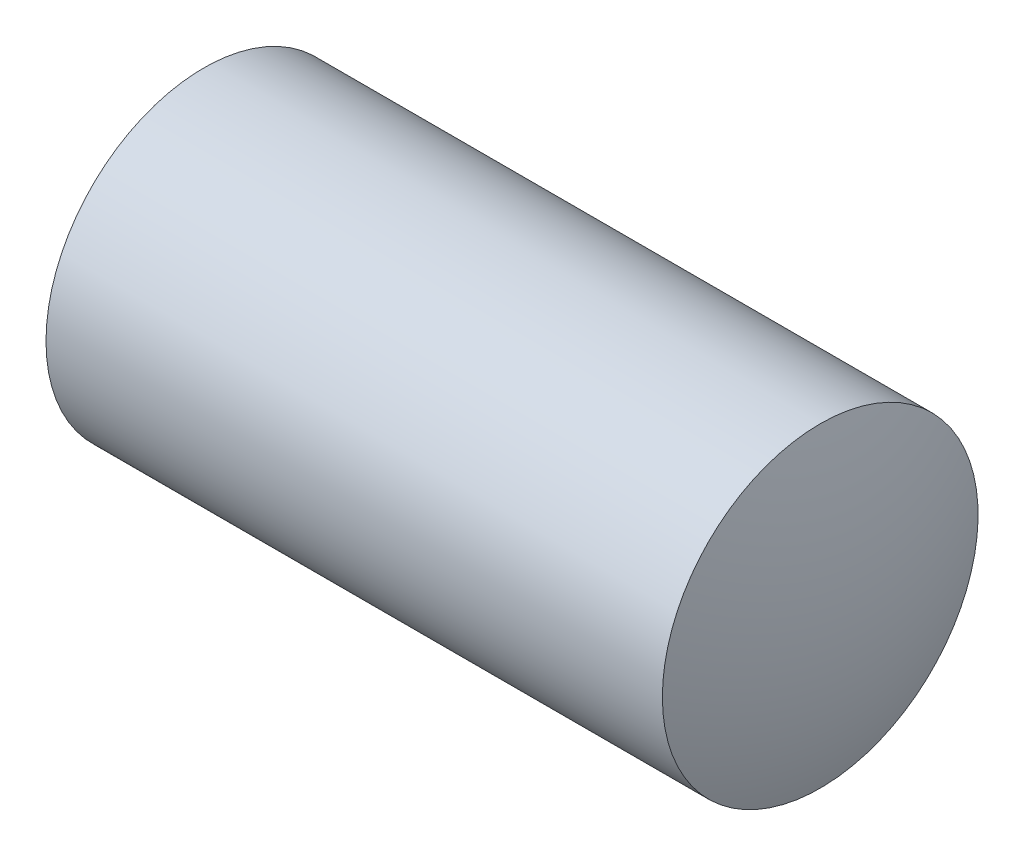
from build123d import *

# Parameters (mm, degrees)
HEX_2_DEPTH = 15


with BuildPart() as part:
    # BodySke → BaseBody (revolve)
    with BuildSketch(Plane.XY):
        with BuildLine():
            Line((0, 0), (0, 10.352))
            Line((0, 10.352), (0.951473244, 12))
            Line((0.951473244, 12), (47.811947441, 12))
            ThreePointArc((47.811947441, 12), (49.448514264, 6.098925602), (50, 0))
            Line((50, 0), (0, 0))
        make_face()
    revolve(axis=Axis((-12.7, 0, 0), (1, 0, 0)))

    # Sketch2 → Hex 2 (cut)
    with BuildSketch(Plane.ZY):
        Polygon((3.464101615, 6), (-3.464101615, 6), (-6.92820323, 0), (-3.464101615, -6), (3.464101615, -6), (6.92820323, 0), align=None)
    extrude(amount=-HEX_2_DEPTH, mode=Mode.SUBTRACT)


solid = part.part
